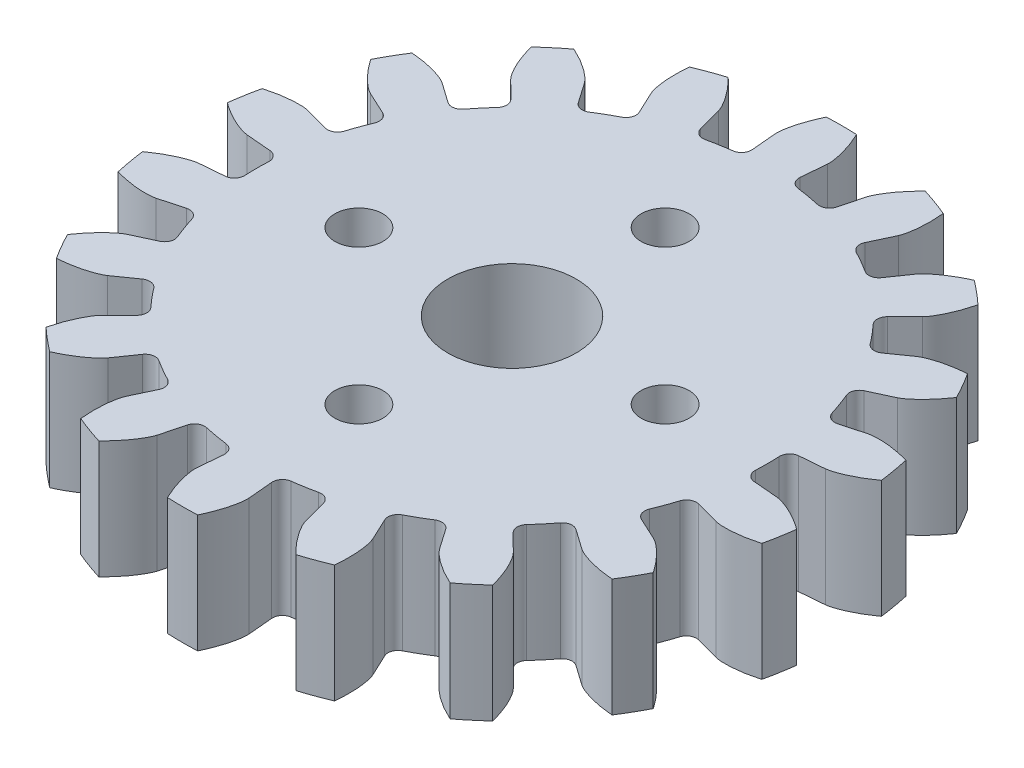
from build123d import *

# Parameters (mm, degrees)
ESQUISSE1_R                        = 14.000044095
BOSS_EXTRU_1_DEPTH                 = 5
ENL_V_MAT_EXTRU_3_DEPTH            = 21.420638318
CONG_1_R                           = 0.422770423
R_P_TITION_CIRCULAIRE2_COUNT       = 18
CONG_1_OF_R_P_TITION_CIRCULAIRE2_R = 0.422770423
ESQUISSE3_R                        = 2.725
ENL_V_MAT_EXTRU_4_DEPTH            = 21.341365586
ESQUISSE4_R                        = 1.02
ENL_V_MAT_EXTRU_5_DEPTH            = 21.341365586
R_P_TITION_CIRCULAIRE3_COUNT       = 4


with BuildPart() as part:
    # Esquisse1 → Boss.-Extru.1 (new body)
    with BuildSketch(Plane(origin=(0, 0, 0), x_dir=(1, 0, 0), z_dir=(0, 1, 0))):
        Circle(ESQUISSE1_R)
    extrude(amount=BOSS_EXTRU_1_DEPTH)

    # Esquisse2 → Enlèv. mat.-Extru.3 (cut, through all)
    with BuildSketch(Plane(origin=(0, 5, 0), x_dir=(1, 0, 0), z_dir=(0, 1, 0))):
        with BuildLine():
            Line((12.281087975, 1.035892571), (10.811641621, 0.911946829))
            ThreePointArc((10.811641621, 0.911946829), (10.850034173, 0), (10.811641621, -0.911946829))
            Line((10.811641621, -0.911946829), (12.281087975, -1.035892571))
            add(Edge.make_bspline(
                [(12.281087975, -1.035892571), (12.283721622, -1.03614498), (12.291099886, -1.036945956), (12.305014601, -1.038827564), (12.327666255, -1.042419159), (12.356444855, -1.047761279), (12.393538031, -1.055544651), (12.437092926, -1.065842687), (12.484800442, -1.078341614), (12.536522861, -1.093213761), (12.587954628, -1.109176099), (12.639095093, -1.126145404), (12.689884535, -1.143992147), (12.751215391, -1.166722741), (12.824485009, -1.195524273), (12.909706777, -1.231435955), (13.005848803, -1.274813588), (13.103256216, -1.321847846), (13.198620082, -1.370448639), (13.294385897, -1.422212104), (13.386626851, -1.474179327), (13.481802733, -1.530871314), (13.569334125, -1.584581734), (13.666667544, -1.647750343), (13.745004658, -1.699602702), (13.825294357, -1.755655306), (13.864277673, -1.78330344), (13.884160496, -1.79758782)],
                knots=[0, 0, 0, 0, 0, 0.005376749, 0.015083688, 0.02853182, 0.04661014, 0.064854849, 0.092110526, 0.119476176, 0.146842496, 0.174208854, 0.201574956, 0.228941013, 0.256307345, 0.307035032, 0.361767352, 0.416499661, 0.471231937, 0.525964282, 0.580696616, 0.635428982, 0.690161387, 0.744893688, 0.799626082, 0.854358407, 0.909090914, 0.909090914, 0.909090914, 0.909090914, 0.909090914], degree=4))
            ThreePointArc((13.884160496, -1.79758782), (14.000044095, 0), (13.884160496, 1.79758782))
            add(Edge.make_bspline(
                [(12.281087975, 1.035892571), (12.283721622, 1.03614498), (12.291099886, 1.036945956), (12.305014601, 1.038827564), (12.327666255, 1.042419159), (12.356444855, 1.047761279), (12.393538031, 1.055544651), (12.437092926, 1.065842687), (12.484800442, 1.078341614), (12.536522861, 1.093213761), (12.587954628, 1.109176099), (12.639095093, 1.126145404), (12.689884535, 1.143992147), (12.751215391, 1.166722741), (12.824485009, 1.195524273), (12.909706777, 1.231435955), (13.005848803, 1.274813588), (13.103256216, 1.321847846), (13.198620082, 1.370448639), (13.294385897, 1.422212104), (13.386626851, 1.474179327), (13.481802733, 1.530871314), (13.569334125, 1.584581734), (13.666667544, 1.647750343), (13.745004658, 1.699602702), (13.825294357, 1.755655306), (13.864277673, 1.78330344), (13.884160496, 1.79758782)],
                knots=[0, 0, 0, 0, 0, 0.005376749, 0.015083688, 0.02853182, 0.04661014, 0.064854849, 0.092110526, 0.119476176, 0.146842496, 0.174208854, 0.201574956, 0.228941013, 0.256307345, 0.307035032, 0.361767352, 0.416499661, 0.471231937, 0.525964282, 0.580696616, 0.635428982, 0.690161387, 0.744893688, 0.799626082, 0.854358407, 0.909090914, 0.909090914, 0.909090914, 0.909090914, 0.909090914], degree=4))
        make_face()
    enl_v_mat_extru_3 = extrude(amount=-ENL_V_MAT_EXTRU_3_DEPTH, mode=Mode.SUBTRACT)

    # Congé1
    cong_1_edges = [part.edges().sort_by_distance(p)[0] for p in [
        (10.811641621, 2.5, 0.911946829),
        (10.811641621, 2.5, -0.911946829),
    ]]
    fillet(cong_1_edges, radius=CONG_1_R)

    # Répétition circulaire2: Enlèv. mat.-Extru.3 ×18 about axis
    r_p_tition_circulaire2_axis = Axis((0, 5, 0), (0, -1, 0))
    for i in range(1, R_P_TITION_CIRCULAIRE2_COUNT):
        add(enl_v_mat_extru_3.rotate(r_p_tition_circulaire2_axis, i * 360 / R_P_TITION_CIRCULAIRE2_COUNT), mode=Mode.SUBTRACT)

    # Congé1 of Répétition circulaire2
    cong_1_of_r_p_tition_circulaire2_edges = [part.edges().sort_by_distance(p)[0] for p in [
        (9.847715665, 2.5, 4.554748923),
        (10.471524035, 2.5, 2.840849511),
        (7.696009862, 2.5, 7.648181075),
        (8.868386107, 2.5, 6.250997474),
        (4.61605169, 2.5, 9.819129715),
        (6.195589931, 2.5, 8.907182886),
        (0.979329558, 2.5, 10.805746396),
        (2.775514173, 2.5, 10.489030586),
        (-2.775514173, 2.5, 10.489030586),
        (-0.979329558, 2.5, 10.805746396),
        (-6.195589931, 2.5, 8.907182886),
        (-4.61605169, 2.5, 9.819129715),
        (-8.868386107, 2.5, 6.250997474),
        (-7.696009862, 2.5, 7.648181075),
        (-10.471524035, 2.5, 2.840849511),
        (-9.847715665, 2.5, 4.554748923),
        (-10.811641621, 2.5, -0.911946829),
        (-10.811641621, 2.5, 0.911946829),
        (-9.847715665, 2.5, -4.554748923),
        (-10.471524035, 2.5, -2.840849511),
        (-7.696009862, 2.5, -7.648181075),
        (-8.868386107, 2.5, -6.250997474),
        (-4.61605169, 2.5, -9.819129715),
        (-6.195589931, 2.5, -8.907182886),
        (-0.979329558, 2.5, -10.805746396),
        (-2.775514173, 2.5, -10.489030586),
        (2.775514173, 2.5, -10.489030586),
        (0.979329558, 2.5, -10.805746396),
        (6.195589931, 2.5, -8.907182886),
        (4.61605169, 2.5, -9.819129715),
        (8.868386107, 2.5, -6.250997474),
        (7.696009862, 2.5, -7.648181075),
        (10.471524035, 2.5, -2.840849511),
        (9.847715665, 2.5, -4.554748923),
    ]]
    fillet(cong_1_of_r_p_tition_circulaire2_edges, radius=CONG_1_OF_R_P_TITION_CIRCULAIRE2_R)

    # Esquisse3 → Enlèv. mat.-Extru.4 (cut, through all)
    with BuildSketch(Plane(origin=(0, 5, 0), x_dir=(1, 0, 0), z_dir=(0, 1, 0))):
        Circle(ESQUISSE3_R)
    extrude(amount=-ENL_V_MAT_EXTRU_4_DEPTH, mode=Mode.SUBTRACT)

    # Esquisse4 → Enlèv. mat.-Extru.5 (cut, through all)
    with BuildSketch(Plane(origin=(0, 5, 0), x_dir=(1, 0, 0), z_dir=(0, 1, 0))):
        with Locations((6.5, 0)):
            Circle(ESQUISSE4_R)
    enl_v_mat_extru_5 = extrude(amount=-ENL_V_MAT_EXTRU_5_DEPTH, mode=Mode.SUBTRACT)

    # Répétition circulaire3: Enlèv. mat.-Extru.5 ×4 about axis
    r_p_tition_circulaire3_axis = Axis((0, 0, 0), (0, 1, 0))
    for i in range(1, R_P_TITION_CIRCULAIRE3_COUNT):
        add(enl_v_mat_extru_5.rotate(r_p_tition_circulaire3_axis, i * 360 / R_P_TITION_CIRCULAIRE3_COUNT), mode=Mode.SUBTRACT)


solid = part.part
